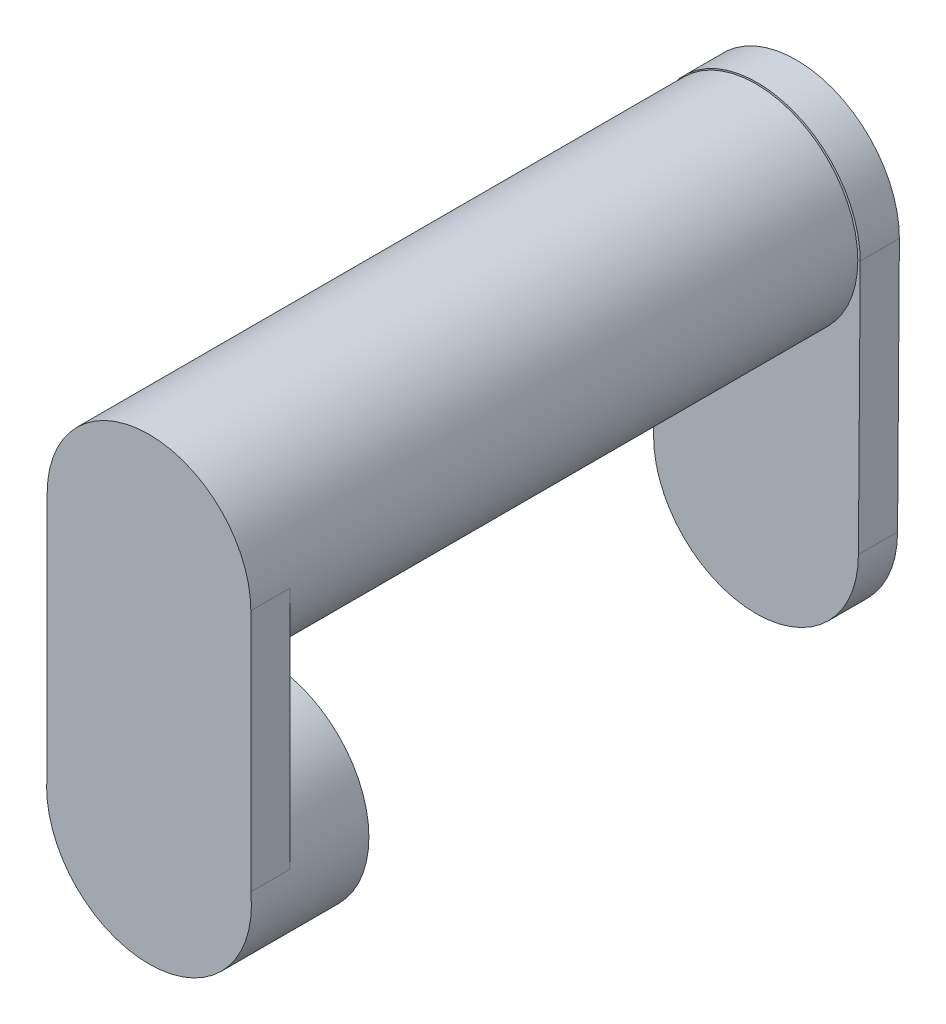
from build123d import *
from build123d.topology import SkipClean

# Parameters (mm, degrees)
SKETCH1_R           = 26.15
SKETCH1_R_2         = 20.4
BOSS_EXTRUDE1_DEPTH = 30
BOSS_EXTRUDE7_DEPTH = 10
SKETCH11_R          = 26
SKETCH11_R_2        = 18
EXTRUDE_THIN1_DEPTH = 145
BOSS_EXTRUDE8_START = 10
BOSS_EXTRUDE8_DEPTH = 10


with BuildPart() as part:
    # Sketch1 → Boss-Extrude1 (new body)
    with BuildSketch(Plane.XY):
        Circle(SKETCH1_R)
        Circle(SKETCH1_R_2, mode=Mode.SUBTRACT)
    extrude(amount=BOSS_EXTRUDE1_DEPTH)

    # Sketch10 → Boss-Extrude7 (add)
    with BuildSketch(Plane.XY.offset(30)):
        with BuildLine():
            Line((-26, 65), (-26, 0))
            ThreePointArc((-26, 0), (0, -26), (26, 0))
            Line((26, 0), (26, 65))
            ThreePointArc((26, 65), (0, 91), (-26, 65))
        make_face()
    extrude(amount=-BOSS_EXTRUDE7_DEPTH)

    # Sketch11 → Extrude-Thin1 (add)
    with SkipClean():  # the faces are left unmerged after this step: merging them gives an invalid solid
        with BuildSketch(Plane(origin=(0, 0, 20), x_dir=(-1, 0, 0), z_dir=(0, 0, -1))):
            with Locations((0, 65)):
                Circle(SKETCH11_R)
            with Locations((0, 65)):
                Circle(SKETCH11_R_2, mode=Mode.SUBTRACT)
        extrude(amount=EXTRUDE_THIN1_DEPTH)
    add(part.part.scale(1), mode=Mode.REPLACE)  # the faces are merged on a copy

    # Sketch12 → Boss-Extrude8 (add)
    with SkipClean():  # the faces are left unmerged after this step: merging them gives an invalid solid
        with BuildSketch(Plane(origin=(0, 0, -125), x_dir=(-1, 0, 0), z_dir=(0, 0, -1)).offset(BOSS_EXTRUDE8_START)):
            with BuildLine():
                ThreePointArc((26.002446969, 63.939646719), (0.305760086, 91.449477206), (-26.613467545, 65.134734686))
                Line((-26.613467545, 65.134734686), (-26.610802329, 64.76017088))
                Line((-26.610802329, 64.76017088), (-26.15, 0))
                ThreePointArc((-26.15, 0), (0, -26.15), (26.15, 0))
                Line((26.15, 0), (26.149721481, 0.120691665))
                Line((26.149721481, 0.120691665), (26.002446969, 63.939646719))
            make_face()
        extrude(amount=-BOSS_EXTRUDE8_DEPTH)


solid = part.part
